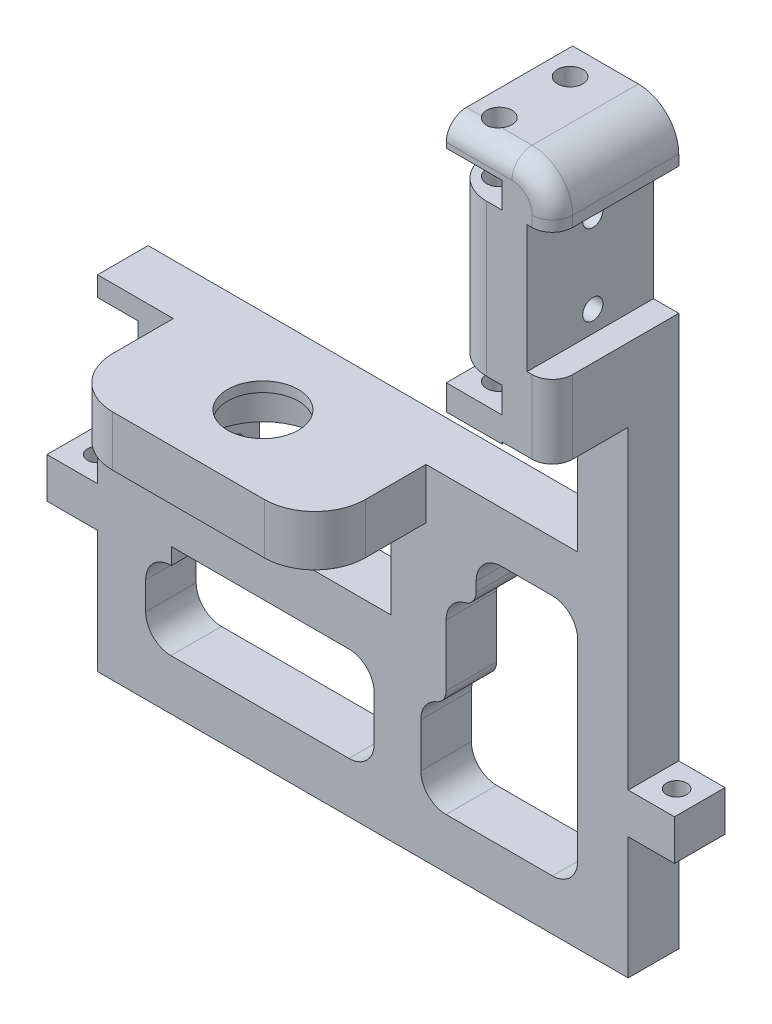
from build123d import *

# Parameters (mm, degrees)
EXTRUDE1_DEPTH               = 10
EXTRUDE2_DEPTH               = 15
FILLET1_R                    = 8
SKETCH3_R                    = 2.5
CUT_EXTRUDE1_DEPTH           = 53.683044042
FILLET4_R                    = 8
FILLET7_R                    = 4
SKETCH4_W                    = 5
SKETCH4_H                    = 25.2
EXTRUDE3_DEPTH               = 117.395755978
F_4_0_4_DIAMETER_HOLE1_D     = 4
F_4_0_4_DIAMETER_HOLE1_DEPTH = 15
SKETCH6_W                    = 50
SKETCH6_H                    = 10
EXTRUDE4_DEPTH               = 22
SKETCH7_W                    = 35.991558426
SKETCH7_H                    = 19.258240123
EXTRUDE5_DEPTH               = 65
SKETCH8_R                    = 7
EXTRUDE6_DEPTH               = 65
SKETCH9_R                    = 11.25
EXTRUDE7_DEPTH               = 8
FILLET8_R                    = 10
SKETCH11_W                   = 10
SKETCH11_H                   = 24.2
EXTRUDE9_DEPTH               = 28
F_4_0_4_DIAMETER_HOLE2_D     = 4
F_4_0_4_DIAMETER_HOLE2_DEPTH = 15
SKETCH13_W                   = 8
SKETCH13_H                   = 22
CUT_EXTRUDE2_DEPTH           = 16
F_4_0_4_DIAMETER_HOLE3_D     = 3.9
F_4_0_4_DIAMETER_HOLE3_DEPTH = 15
EXTRUDE10_DEPTH              = 10
FILLET9_R                    = 5
FILLET10_R                   = 3


with BuildPart() as part:
    # Sketch1 → Extrude1 (new body)
    with BuildSketch(Plane.XY):
        Polygon((-68.067337579, -53.151608792), (46.932662421, -53.151608792), (46.932662421, -28.951608792), (56.08269406, -28.951608792), (56.08269406, -20.951608792), (46.932662421, -20.951608792), (46.932662421, 91.048391208), (36.605660332, 91.048391208), (25.932662421, 91.048391208), (25.932662421, 86.048391208), (36.932662421, 86.048391208), (36.932662421, 80.948391208), (25.932662421, 80.948391208), (25.932662421, 50.948391208), (36.932662421, 50.948391208), (36.932662421, 45.848391208), (25.932662421, 45.848391208), (25.932662421, 40.848391208), (36.932662421, 40.848391208), (36.932662421, 25.69350339), (36.932662421, 22.150468938), (36.932662421, 14.848391208), (-58.067337579, 14.848391208), (-58.067337579, -20.951608792), (-68.067337579, -20.951608792), align=None)
    extrude(amount=EXTRUDE1_DEPTH)

    # Sketch2 → Extrude2 (add)
    with BuildSketch(Plane.XY.offset(10)):
        Polygon((25.932662421, 91.048391208), (46.932662421, 91.048391208), (46.932662421, 41.227475545), (36.932662421, 41.227475545), (36.932662421, 40.848391208), (25.932662421, 40.848391208), (25.932662421, 45.848391208), (36.932662421, 45.848391208), (36.932662421, 50.948391208), (25.932662421, 50.948391208), (25.932662421, 80.948391208), (36.932662421, 80.948391208), (36.932662421, 86.048391208), (25.932662421, 86.048391208), align=None)
    extrude(amount=EXTRUDE2_DEPTH)

    # Fillet1
    fillet1_edges = [part.edges().sort_by_distance(p)[0] for p in [
        (25.932662421, 65.948391208, 0),
        (25.932662421, 65.948391208, 25),
    ]]
    fillet(fillet1_edges, radius=FILLET1_R)

    # Sketch3 → Cut-Extrude1 (cut)
    with BuildSketch(Plane(origin=(0, 91.048391208, 0), x_dir=(-1, 0, 0), z_dir=(0, 1, 0))):
        with Locations(Location((-30.932662421, 5.5, 0), (0, 0, 90))):
            Circle(SKETCH3_R)
        with Locations(Location((-30.932662421, 19.5, 0), (0, 0, 90))):
            Circle(SKETCH3_R)
    extrude(amount=-CUT_EXTRUDE1_DEPTH, mode=Mode.SUBTRACT)

    # Fillet4
    fillet4_edges = [part.edges().sort_by_distance(p)[0] for p in [
        (46.932662421, 91.048391208, 12.5),
    ]]
    fillet(fillet4_edges, radius=FILLET4_R)

    # Fillet7
    # the kernel refuses this fillet: 4 mm, written as the material it takes off along each edge
    with BuildSketch(Plane(origin=(46.932662421, 83.048391208, 25), x_dir=(-1, 0, 0), z_dir=(0, -1, 0))) as fillet7_piece_1:
        with BuildLine():
            CenterArc((FILLET7_R, FILLET7_R), FILLET7_R, 180, 90)
            Line((0, FILLET7_R), (0, 0))
            Line((0, 0), (FILLET7_R, 0))
        make_face()
    extrude(amount=51.820915662, mode=Mode.SUBTRACT)
    with BuildSketch(Plane(origin=(15.932662421, 91.048391208, 25), x_dir=(0, -1, 0), z_dir=(1, 0, 0))) as fillet7_piece_2:
        with BuildLine():
            CenterArc((FILLET7_R, FILLET7_R), FILLET7_R, 180, 90)
            Line((0, FILLET7_R), (0, 0))
            Line((0, 0), (FILLET7_R, 0))
        make_face()
    extrude(amount=23, mode=Mode.SUBTRACT)
    with BuildSketch(Plane(origin=(38.932662421, 83.048391208, 25), x_dir=(0, 1, 0), z_dir=(-1, 0, 0))) as fillet7_piece_3:
        with BuildLine():
            CenterArc((8 - FILLET7_R, FILLET7_R), FILLET7_R, 270, 90)
            Line((8, FILLET7_R), (8, 0))
            Line((8, 0), (8 - FILLET7_R, 0))
        make_face()
    revolve(axis=Axis((38.932662421, 83.048391208, 25), (0, 0, -1)), revolution_arc=90, mode=Mode.SUBTRACT)

    # Sketch4 → Extrude3 (cut, through all)
    with BuildSketch(Plane(origin=(0, 0, 0), x_dir=(-1, 0, 0), z_dir=(0, 0, -1))):
        with Locations((-44.432662421, 68.348391208)):
            Rectangle(SKETCH4_W, SKETCH4_H)
    extrude(amount=-EXTRUDE3_DEPTH, mode=Mode.SUBTRACT)

    # Ø4.0 (4) Diameter Hole1
    with Locations(Plane(origin=(41.932662421, 75.948391208, 12), x_dir=(0, 1, 0), z_dir=(1, 0, 0))):
        with Locations((0, 0), (-16, 0)):
            Hole(F_4_0_4_DIAMETER_HOLE1_D / 2, depth=F_4_0_4_DIAMETER_HOLE1_DEPTH)

    # Sketch6 → Extrude4 (add)
    with BuildSketch(Plane.XY.offset(10)):
        with Locations((-18.067337579, 9.848391208)):
            Rectangle(SKETCH6_W, SKETCH6_H)
    extrude(amount=EXTRUDE4_DEPTH)

    # Sketch7 → Extrude5 (cut)
    with BuildSketch(Plane.XY.offset(10)):
        with Locations((-17.995779213, -4.780728854)):
            Rectangle(SKETCH7_W, SKETCH7_H)
    extrude(amount=-EXTRUDE5_DEPTH, mode=Mode.SUBTRACT)

    # Sketch8 → Extrude6 (cut)
    with BuildSketch(Plane.XZ.offset(-4.848391208)):
        with Locations((-18.567337579, 16.771243445)):
            Circle(SKETCH8_R)
    extrude(amount=-EXTRUDE6_DEPTH, mode=Mode.SUBTRACT)

    # Sketch9 → Extrude7 (cut)
    with BuildSketch(Plane.XZ.offset(-4.848391208)):
        with Locations((-18.567337579, 16.771243445)):
            Circle(SKETCH9_R)
    extrude(amount=-EXTRUDE7_DEPTH, mode=Mode.SUBTRACT)

    # Fillet8
    fillet8_edges = [part.edges().sort_by_distance(p)[0] for p in [
        (6.932662421, 9.848391208, 32),
        (-43.067337579, 9.848391208, 32),
    ]]
    fillet(fillet8_edges, radius=FILLET8_R)

    # Sketch11 → Extrude9 (cut)
    with BuildSketch(Plane.XY.offset(10)):
        with Locations((-63.067337579, -41.051608792)):
            Rectangle(SKETCH11_W, SKETCH11_H)
    extrude(amount=-EXTRUDE9_DEPTH, mode=Mode.SUBTRACT)

    # Ø4.0 (4) Diameter Hole2
    with Locations(Plane(origin=(-63.067337579, -20.951608792, 5), x_dir=(1, 0, 0), z_dir=(0, 1, 0))):
        with Locations((0, 0), (114.57501582, 0)):
            Hole(F_4_0_4_DIAMETER_HOLE2_D / 2, depth=F_4_0_4_DIAMETER_HOLE2_DEPTH)

    # Sketch13 → Cut-Extrude2 (cut)
    with BuildSketch(Plane.XY.offset(10)):
        with Locations((-54.067337579, -0.049611207)):
            Rectangle(SKETCH13_W, SKETCH13_H)
    extrude(amount=-CUT_EXTRUDE2_DEPTH, mode=Mode.SUBTRACT)

    # Ø4.0 (4) Diameter Hole3
    with Locations(Plane(origin=(-50.067337579, 5.950388793, 5), x_dir=(0, 0, -1), z_dir=(-1, 0, 0))):
        with Locations((0, 0), (0, 12)):
            Hole(F_4_0_4_DIAMETER_HOLE3_D / 2, depth=F_4_0_4_DIAMETER_HOLE3_DEPTH)

    # Sketch10 → Extrude10 (cut)
    with BuildSketch(Plane.XY.offset(10)):
        Polygon((36.932662421, 4.848391208), (16.848954564, 4.848391208), (16.848954564, -4.813402299), (10.897809309, -4.813402299), (10.897809309, -24.409848915), (5.891741908, -24.409848915), (5.891741908, -43.151608792), (10.897809309, -43.151608792), (16.848954564, -43.151608792), (36.932662421, -43.151608792), align=None)
        Polygon((-43.449854697, -27.668574095), (-48.552654799, -27.668574095), (-48.552654799, -43.151608792), (-45.604016638, -43.151608792), (-3.328472946, -43.151608792), (-3.328472946, -24.409848915), (-43.449854697, -24.409848915), align=None)
    extrude(amount=-EXTRUDE10_DEPTH, mode=Mode.SUBTRACT)

    # Fillet9
    fillet9_edges = [part.edges().sort_by_distance(p)[0] for p in [
        (36.932662421, 4.848391208, 5),
        (36.932662421, -43.151608792, 5),
        (5.891741908, -43.151608792, 5),
        (5.891741908, -24.409848915, 5),
        (10.897809309, -4.813402299, 5),
        (16.848954564, 4.848391208, 5),
        (-3.328472946, -43.151608792, 5),
        (-48.552654799, -43.151608792, 5),
        (-48.552654799, -27.668574095, 5),
        (-3.328472946, -24.409848915, 5),
    ]]
    fillet(fillet9_edges, radius=FILLET9_R)

    # Fillet10
    fillet10_edges = [part.edges().sort_by_distance(p)[0] for p in [
        (-43.449854697, -26.039211505, 0),
        (16.848954564, -4.813402299, 5),
        (10.897809309, -24.409848915, 5),
    ]]
    fillet(fillet10_edges, radius=FILLET10_R)


solid = part.part
